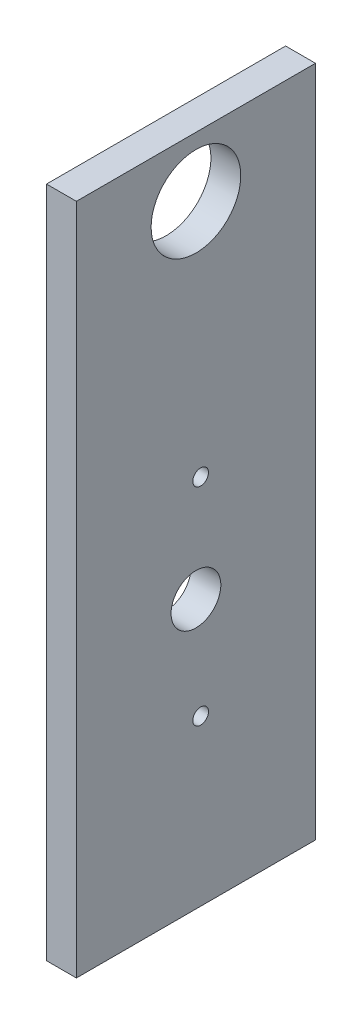
from build123d import *

# Parameters (mm, degrees)
SKETCH1_W           = 9.525
SKETCH1_H           = 76.2
BOSS_EXTRUDE1_DEPTH = 107.188
SKETCH3_R           = 14.2875
CUT_EXTRUDE2_DEPTH  = 45.974
SKETCH4_R           = 2.499999953
SKETCH4_R_2         = 7.9248
CUT_EXTRUDE3_DEPTH  = 115.156046572


with BuildPart() as part:
    # Sketch1 → Boss-Extrude1 (new, symmetric)
    with BuildSketch(Plane(origin=(0, 0, 0), x_dir=(1, 0, 0), z_dir=(0, 1, 0))):
        Rectangle(SKETCH1_W, SKETCH1_H)
    extrude(amount=BOSS_EXTRUDE1_DEPTH, both=True)

    # Sketch3 → Cut-Extrude2 (cut)
    with BuildSketch(Plane.ZY.offset(4.7625)):
        with Locations((0, 88.138)):
            Circle(SKETCH3_R)
    extrude(amount=-CUT_EXTRUDE2_DEPTH, mode=Mode.SUBTRACT)

    # Sketch4 → Cut-Extrude3 (cut, through all)
    with BuildSketch(Plane.ZY.offset(4.7625)):
        with Locations((-1.500000048, 11.312372418)):
            Circle(SKETCH4_R)
        with Locations((-1.500000048, -54.687627662)):
            Circle(SKETCH4_R)
        with Locations((0, -21.687627622)):
            Circle(SKETCH4_R_2)
    extrude(amount=-CUT_EXTRUDE3_DEPTH, mode=Mode.SUBTRACT)


solid = part.part
